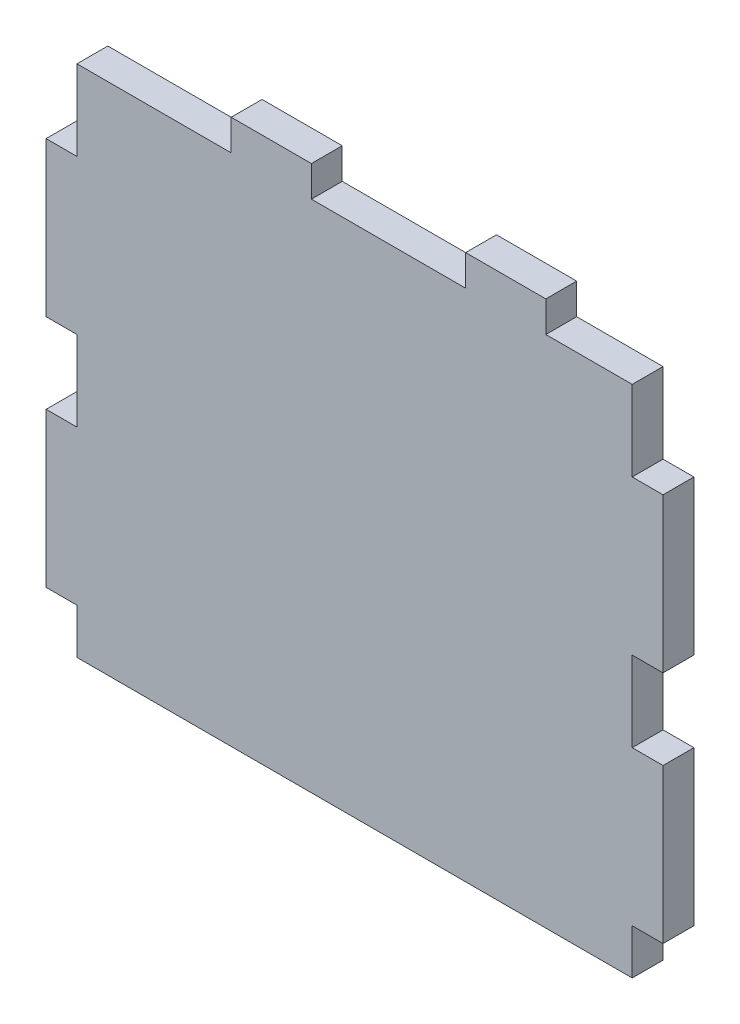
from build123d import *

# Parameters (mm, degrees)
SKETCH1_W           = 60
SKETCH1_H           = 50
BOSS_EXTRUDE1_DEPTH = 3
SKETCH2_W           = 3
SKETCH2_H           = 7.8
CUT_EXTRUDE1_DEPTH  = 53.999062732
LPATTERN1_COUNT     = 3
LPATTERN1_PITCH     = 22.8
SKETCH3_W           = 3
SKETCH3_H           = 7.8
CUT_EXTRUDE2_DEPTH  = 53.999062732
LPATTERN2_COUNT     = 4
LPATTERN2_PITCH     = 22.8
SKETCH6_W           = 3
SKETCH6_H           = 19.4
CUT_EXTRUDE3_DEPTH  = 10
SKETCH7_W           = 7.8
SKETCH7_H           = 3
BOSS_EXTRUDE2_DEPTH = 3
LPATTERN3_COUNT     = 2
LPATTERN3_PITCH     = 22.8
SKETCH8_W           = 3
SKETCH8_H           = 15
BOSS_EXTRUDE3_DEPTH = 3


with BuildPart() as part:
    # Sketch1 → Boss-Extrude1 (new body)
    with BuildSketch(Plane.XY):
        with Locations((-10.993460648, -8.457986111)):
            Rectangle(SKETCH1_W, SKETCH1_H)
    extrude(amount=BOSS_EXTRUDE1_DEPTH)

    # Sketch2 → Cut-Extrude1 (cut, through all)
    with BuildSketch(Plane.XY.offset(3)):
        with Locations((-39.493460648, 12.642013889)):
            Rectangle(SKETCH2_W, SKETCH2_H)
    cut_extrude1 = extrude(amount=-CUT_EXTRUDE1_DEPTH, mode=Mode.SUBTRACT)

    # LPattern1: Cut-Extrude1 ×3
    with Locations(*[(0, -i * LPATTERN1_PITCH, 0) for i in range(1, LPATTERN1_COUNT)]):
        add(cut_extrude1, mode=Mode.SUBTRACT)

    # Sketch3 → Cut-Extrude2 (cut, through all)
    with BuildSketch(Plane.XY.offset(3)):
        with Locations((17.506539352, 12.642013889)):
            Rectangle(SKETCH3_W, SKETCH3_H)
    cut_extrude2 = extrude(amount=-CUT_EXTRUDE2_DEPTH, mode=Mode.SUBTRACT)

    # LPattern2: Cut-Extrude2 ×4
    with Locations(*[(0, -i * LPATTERN2_PITCH, 0) for i in range(1, LPATTERN2_COUNT)]):
        add(cut_extrude2, mode=Mode.SUBTRACT)

    # Sketch6 → Cut-Extrude3 (cut)
    with BuildSketch(Plane.XY.offset(3)):
        with Locations((-39.493460648, -23.757986111)):
            Rectangle(SKETCH6_W, SKETCH6_H)
    extrude(amount=-CUT_EXTRUDE3_DEPTH, mode=Mode.SUBTRACT)

    # Sketch7 → Boss-Extrude2 (add)
    with BuildSketch(Plane(origin=(0, 16.542013889, 0), x_dir=(1, 0, 0), z_dir=(0, 1, 0))):
        with Locations((-19.093460648, -1.5)):
            Rectangle(SKETCH7_W, SKETCH7_H)
    boss_extrude2 = extrude(amount=BOSS_EXTRUDE2_DEPTH)

    # LPattern3: Boss-Extrude2 ×2
    with Locations(*[(i * LPATTERN3_PITCH, 0, 0) for i in range(1, LPATTERN3_COUNT)]):
        add(boss_extrude2)

    # Sketch8 → Boss-Extrude3 (add)
    with BuildSketch(Plane.ZY.offset(37.993460648)):
        with Locations((1.5, -21.557986111)):
            Rectangle(SKETCH8_W, SKETCH8_H)
    extrude(amount=BOSS_EXTRUDE3_DEPTH)


solid = part.part
